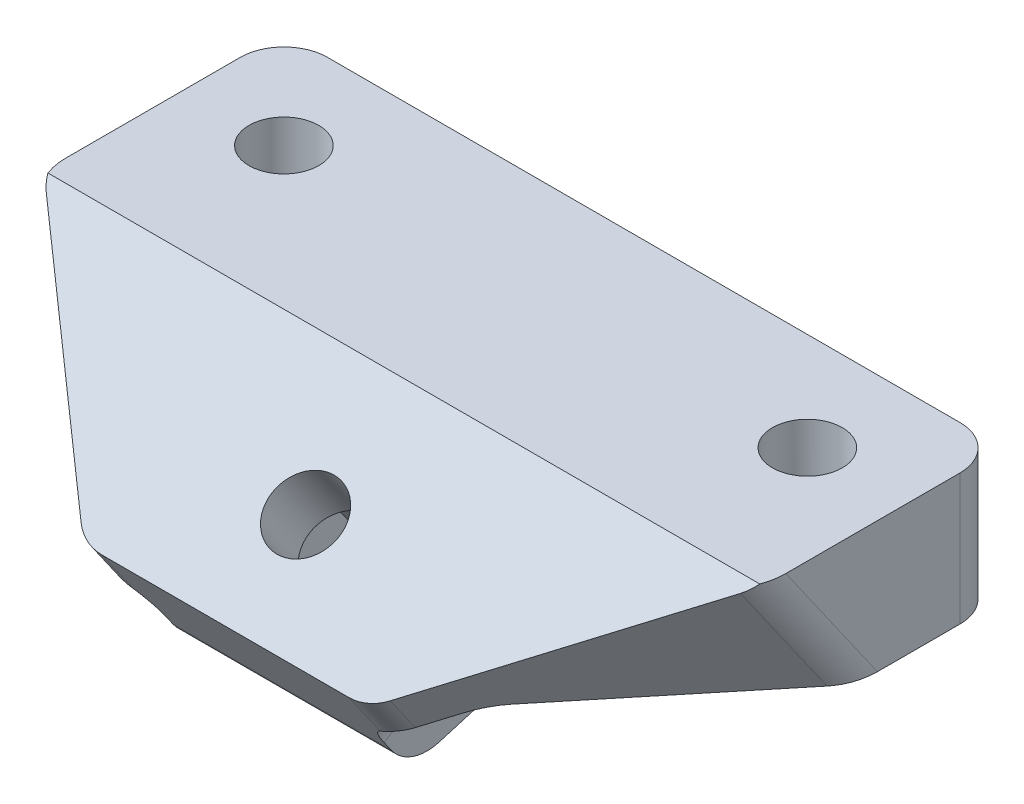
from build123d import *

# Parameters (mm, degrees)
EXTRU_MINCE1_DEPTH      = 16.5
ENL_V_MAT_EXTRU_5_DEPTH = 37.379072455
BOSS_EXTRU_1_DEPTH      = 5
ESQUISSE2_R             = 1.6
ENL_V_MAT_EXTRU_1_DEPTH = 23.509707076
ESQUISSE3_R             = 1.6
ENL_V_MAT_EXTRU_2_DEPTH = 23.509707076
ENL_V_START             = -3
ENL_V_MAT_EXTRU_3_DEPTH = 20.509707076
ENL_V_MAT_EXTRU_4_DEPTH = 20.509707076
CHANFREIN1_SIZE         = 10
CONG_1_R                = 2


with BuildPart() as part:
    # Esquisse1 → Extru.-Mince1 (new, symmetric)
    with BuildSketch(Plane(origin=(0, 0, 0), x_dir=(0, 0, -1), z_dir=(1, 0, 0))):
        Polygon((11, 0), (0, 0), (-8.191520443, -5.735764364), (-4.750061825, -10.650676629), (1.891792733, -6), (11, -6), align=None)
    extrude(amount=EXTRU_MINCE1_DEPTH, both=True)

    # Esquisse7 → Enlèv. mat.-Extru.5 (cut, through all)
    with BuildSketch(Plane.ZY.offset(16.5)):
        Polygon((-1.891792733, -6), (5.081994449, -6), (7.04436757, -7.374068452), (4.750061825, -10.650676629), align=None)
    extrude(amount=-ENL_V_MAT_EXTRU_5_DEPTH, mode=Mode.SUBTRACT)

    # Esquisse6 → Boss.-Extru.1 (add, symmetric)
    with BuildSketch(Plane(origin=(0, 0, 0), x_dir=(0, 0, -1), z_dir=(1, 0, 0))):
        Polygon((1.891792733, -6), (11, -6), (-4.750061825, -10.650676629), (-8.191520443, -5.735764364), (-5.081994449, -6), align=None)
    extrude(amount=BOSS_EXTRU_1_DEPTH, both=True)

    # Esquisse2 → Enlèv. mat.-Extru.1 (cut, through all)
    with BuildSketch(Plane(origin=(0, 0, 0), x_dir=(1, 0, 0), z_dir=(0, 1, 0))):
        with Locations(Location((-12, 6.5, 0), (0, 0, 270))):
            Circle(ESQUISSE2_R)
        with Locations(Location((12, 6.5, 0), (0, 0, 90))):
            Circle(ESQUISSE2_R)
    extrude(amount=-ENL_V_MAT_EXTRU_1_DEPTH, mode=Mode.SUBTRACT)

    # Esquisse3 → Enlèv. mat.-Extru.2 (cut, through all)
    with BuildSketch(Plane(origin=(0, 0, 0), x_dir=(1, 0, 0), z_dir=(0, 0.819152044288991, 0.5735764363510473))):
        with Locations(Location((0, -5.5, 0), (0, 0, 270))):
            Circle(ESQUISSE3_R)
    extrude(amount=-ENL_V_MAT_EXTRU_2_DEPTH, mode=Mode.SUBTRACT)

    # Esquisse4 → Enlèv. mat.-Extru.3 (cut, through all)
    with BuildSketch(Plane(origin=(0, 0, 0), x_dir=(1, 0, 0), z_dir=(0, 1, 0)).offset(ENL_V_START)):
        Polygon((-9.25, 8.08771324), (-12, 9.675426481), (-14.75, 8.08771324), (-14.75, 4.91228676), (-12, 3.324573519), (-9.25, 4.91228676), align=None)
        Polygon((14.75, 8.08771324), (12, 9.675426481), (9.25, 8.08771324), (9.25, 4.91228676), (12, 3.324573519), (14.75, 4.91228676), align=None)
    extrude(amount=-ENL_V_MAT_EXTRU_3_DEPTH, mode=Mode.SUBTRACT)

    # Esquisse5 → Enlèv. mat.-Extru.4 (cut, through all)
    with BuildSketch(Plane(origin=(0, 0, 0), x_dir=(1, 0, 0), z_dir=(0, 0.819152044288991, 0.5735764363510474)).offset(ENL_V_START)):
        Polygon((2.75, -3.91228676), (0, -2.324573519), (-2.75, -3.91228676), (-2.75, -7.08771324), (0, -8.675426481), (2.75, -7.08771324), align=None)
    extrude(amount=-ENL_V_MAT_EXTRU_4_DEPTH, mode=Mode.SUBTRACT)

    # Chanfrein1
    chanfrein1_edges = [part.edges().sort_by_distance(p)[0] for p in [
        (-16.5, -6.554916408, 7.617944007),
        (16.5, -6.554916408, 7.617944007),
    ]]
    chamfer(chanfrein1_edges, length=CHANFREIN1_SIZE)

    # Congé1
    # the kernel refuses this fillet: 2 mm, written as the material it adds along each edge
    with BuildSketch(Plane(origin=(7, -8, 4.451396871), x_dir=(0, 0.819152044288991, 0.5735764363510474), z_dir=(-1, 0, 0))) as cong_1_piece_1_section:
        Polygon((0, 0), (CONG_1_R, 0), (CONG_1_R, CONG_1_R * 0.315298788879), (CONG_1_R * 0.819152044289, CONG_1_R * 0.573576436351), align=None)
    cong_1_piece_1 = extrude(amount=CONG_1_R, mode=Mode.PRIVATE)
    cong_1_piece_1 = cong_1_piece_1 - Plane(origin=(7, -8, 4.451396871), x_dir=(0, -0.9537169507482266, -0.30070579950427384), z_dir=(-1, 0, 0)) * Sphere(CONG_1_R, mode=Mode.PRIVATE)
    add(cong_1_piece_1)
    with BuildSketch(Plane(origin=(-7, -8, 4.451396871), x_dir=(0, 1, 0), z_dir=(1, 0, 0))) as cong_1_piece_2_section:
        Polygon((0, 0), (CONG_1_R, 0), (CONG_1_R, CONG_1_R * 0.315298788879), (CONG_1_R * 0.819152044289, CONG_1_R * 0.573576436351), align=None)
    cong_1_piece_2 = extrude(amount=CONG_1_R, mode=Mode.PRIVATE)
    cong_1_piece_2 = cong_1_piece_2 - Plane(origin=(-7, -8, 4.451396871), x_dir=(0, -0.9537169507482266, -0.30070579950427384), z_dir=(1, 0, 0)) * Sphere(CONG_1_R, mode=Mode.PRIVATE)
    add(cong_1_piece_2)
    with BuildSketch(Plane(origin=(7, -6, 5.081994449), x_dir=(0, 0, -1), z_dir=(1, 0, 0))) as cong_1_piece_3_section:
        with BuildLine():
            CenterArc((CONG_1_R * 0.315298788879, -CONG_1_R), CONG_1_R, 90, 35)
            Line((-CONG_1_R * 0.258277647472, -CONG_1_R * 0.180847955711), (0, 0))
            Line((0, 0), (CONG_1_R * 0.315298788879, 0))
        make_face()
    cong_1_piece_3 = extrude(amount=3.472109184, mode=Mode.PRIVATE)
    cong_1_piece_3 = split(cong_1_piece_3, bisect_by=Plane(origin=(8.435798526, -6.333350621, 5.409912391), z_dir=(-0.7071067811865476, 0.40557978767263964, -0.5792279653395686)), keep=Keep.TOP, mode=Mode.PRIVATE)
    add(cong_1_piece_3)
    with BuildSketch(Plane(origin=(-10.472109184, -6, 5.081994449), x_dir=(0, 0, -1), z_dir=(1, 0, 0))) as cong_1_piece_4_section:
        with BuildLine():
            CenterArc((CONG_1_R * 0.315298788879, -CONG_1_R), CONG_1_R, 90, 35)
            Line((-CONG_1_R * 0.258277647472, -CONG_1_R * 0.180847955711), (0, 0))
            Line((0, 0), (CONG_1_R * 0.315298788879, 0))
        make_face()
    cong_1_piece_4 = extrude(amount=3.472109184, mode=Mode.PRIVATE)
    cong_1_piece_4 = split(cong_1_piece_4, bisect_by=Plane(origin=(-8.435798526, -6.333350621, 5.409912391), z_dir=(0.7071067811865476, 0.40557978767263964, -0.5792279653395686)), keep=Keep.TOP, mode=Mode.PRIVATE)
    add(cong_1_piece_4)
    with BuildSketch(Plane(origin=(-5, -7.374068452, 7.04436757), x_dir=(-1, 0, 0), z_dir=(0, 0.5735764363510474, -0.819152044288991))) as cong_1_piece_5_section:
        with BuildLine():
            CenterArc((CONG_1_R, -CONG_1_R), CONG_1_R, 90, 90)
            Line((0, -CONG_1_R), (0, 0))
            Line((0, 0), (CONG_1_R, 0))
        make_face()
    cong_1_piece_5 = extrude(amount=1.765017662, mode=Mode.PRIVATE)
    cong_1_piece_5 = split(cong_1_piece_5, bisect_by=Plane(origin=(-6.416553747, -7.794178032, 6.852072741), z_dir=(0.7071067811865476, 0.40557978767263964, -0.5792279653395686)), keep=Keep.TOP, mode=Mode.PRIVATE)
    add(cong_1_piece_5)
    with BuildSketch(Plane(origin=(5, -7.374068452, 7.04436757), x_dir=(1, 0, 0), z_dir=(0, 0.5735764363510474, -0.819152044288991))) as cong_1_piece_6_section:
        with BuildLine():
            CenterArc((CONG_1_R, CONG_1_R), CONG_1_R, 180, 90)
            Line((0, CONG_1_R), (0, 0))
            Line((0, 0), (CONG_1_R, 0))
        make_face()
    cong_1_piece_6 = extrude(amount=1.765017662, mode=Mode.PRIVATE)
    cong_1_piece_6 = split(cong_1_piece_6, bisect_by=Plane(origin=(6.416553747, -7.794178032, 6.852072741), z_dir=(-0.7071067811865476, 0.40557978767263964, -0.5792279653395686)), keep=Keep.TOP, mode=Mode.PRIVATE)
    add(cong_1_piece_6)
    with BuildSketch(Plane(origin=(5, -6, 4.451396871), x_dir=(1, 0, 0), z_dir=(0, 0, -1))) as cong_1_piece_7_section:
        with BuildLine():
            CenterArc((CONG_1_R, CONG_1_R), CONG_1_R, 180, 90)
            Line((0, CONG_1_R), (0, 0))
            Line((0, 0), (CONG_1_R, 0))
        make_face()
    cong_1_piece_7 = extrude(amount=15.451396871, mode=Mode.PRIVATE)
    cong_1_piece_7 = split(cong_1_piece_7, bisect_by=Plane(origin=(5.479319135, -8.319320936, -3.145347646), z_dir=(0, 0.9590632108966768, 0.2831920858791019)), keep=Keep.TOP, mode=Mode.PRIVATE)
    add(cong_1_piece_7)
    with BuildSketch(Plane(origin=(-5, -6, -11), x_dir=(-1, 0, 0), z_dir=(0, 0, 1))) as cong_1_piece_8_section:
        with BuildLine():
            CenterArc((CONG_1_R, CONG_1_R), CONG_1_R, 180, 90)
            Line((0, CONG_1_R), (0, 0))
            Line((0, 0), (CONG_1_R, 0))
        make_face()
    cong_1_piece_8 = extrude(amount=15.451396871, mode=Mode.PRIVATE)
    cong_1_piece_8 = split(cong_1_piece_8, bisect_by=Plane(origin=(-5.479319135, -8.319320936, -3.145347646), z_dir=(0, 0.9590632108966768, 0.2831920858791019)), keep=Keep.TOP, mode=Mode.PRIVATE)
    add(cong_1_piece_8)
    # the kernel refuses this fillet: 2 mm, written as the material it takes off along each edge
    with BuildSketch(Plane(origin=(-16.5, 1.696519432, 1.187915695), x_dir=(0, 0.5735764363510472, -0.8191520442889909), z_dir=(0, -0.819152044288991, -0.5735764363510473)), Plane(origin=(16.5, 1.696519432, 1.187915695), x_dir=(-0.7071067811865467, -0.40557978767264014, 0.5792279653395693), z_dir=(0, -0.819152044288991, -0.5735764363510473))) as cong_1_2_piece_1:
        with BuildLine():
            CenterArc((CONG_1_R * 0.414213562373, CONG_1_R), CONG_1_R, 225, 45)
            Line((-CONG_1_R * 0.292893218813, CONG_1_R * 0.292893218813), (0, 0))
            Line((0, 0), (CONG_1_R * 0.414213562373, 0))
        make_face()
    extrude(amount=11.466783156, mode=Mode.SUBTRACT)
    with BuildSketch(Plane(origin=(6.5, -9.12261086, 5.820024995), x_dir=(-1, 0, 0), z_dir=(0, 0.8191520442889916, 0.5735764363510465))) as cong_1_2_piece_2:
        with BuildLine():
            CenterArc((CONG_1_R * 0.414213562373, -CONG_1_R), CONG_1_R, 90, 45)
            Line((-CONG_1_R * 0.292893218813, -CONG_1_R * 0.292893218813), (0, 0))
            Line((0, 0), (CONG_1_R * 0.414213562373, 0))
        make_face()
    extrude(amount=6.205643951, mode=Mode.SUBTRACT)
    with BuildSketch(Plane(origin=(-6.5, -9.12261086, 5.820024995), x_dir=(1, 0, 0), z_dir=(-1.721686136418026e-15, 0.8191520442889914, 0.5735764363510468))) as cong_1_2_piece_3:
        with BuildLine():
            CenterArc((CONG_1_R * 0.414213562373, CONG_1_R), CONG_1_R, 225, 45)
            Line((-CONG_1_R * 0.292893218813, CONG_1_R * 0.292893218813), (0, 0))
            Line((0, 0), (CONG_1_R * 0.414213562373, 0))
        make_face()
    extrude(amount=6.205643951, mode=Mode.SUBTRACT)
    with BuildSketch(Plane(origin=(16.5, -11, -11), x_dir=(0, 0, 1), z_dir=(0, 1, 0))) as cong_1_2_piece_4:
        with BuildLine():
            CenterArc((CONG_1_R, -CONG_1_R), CONG_1_R, 90, 90)
            Line((0, -CONG_1_R), (0, 0))
            Line((0, 0), (CONG_1_R, 0))
        make_face()
    extrude(amount=16, mode=Mode.SUBTRACT)
    with BuildSketch(Plane(origin=(8.596227372, -10.650676629, 4.750061825), x_dir=(0, 0.2831920858791011, -0.9590632108966769), z_dir=(-1, 0, 0))) as cong_1_2_piece_5:
        with BuildLine():
            CenterArc((CONG_1_R * 0.719245474399, -CONG_1_R), CONG_1_R, 90, 71.450811124)
            Line((-CONG_1_R * 0.22880542283, -CONG_1_R * 0.681881317333), (0, 0))
            Line((0, 0), (CONG_1_R * 0.719245474399, 0))
        make_face()
    extrude(amount=17.192454744, mode=Mode.SUBTRACT)
    with BuildSketch(Plane(origin=(-16.5, -11, -11), x_dir=(0, 0, 1), z_dir=(0, 1, 0))) as cong_1_2_piece_6:
        with BuildLine():
            CenterArc((CONG_1_R, CONG_1_R), CONG_1_R, 180, 90)
            Line((0, CONG_1_R), (0, 0))
            Line((0, 0), (CONG_1_R, 0))
        make_face()
    extrude(amount=16, mode=Mode.SUBTRACT)


solid = part.part
